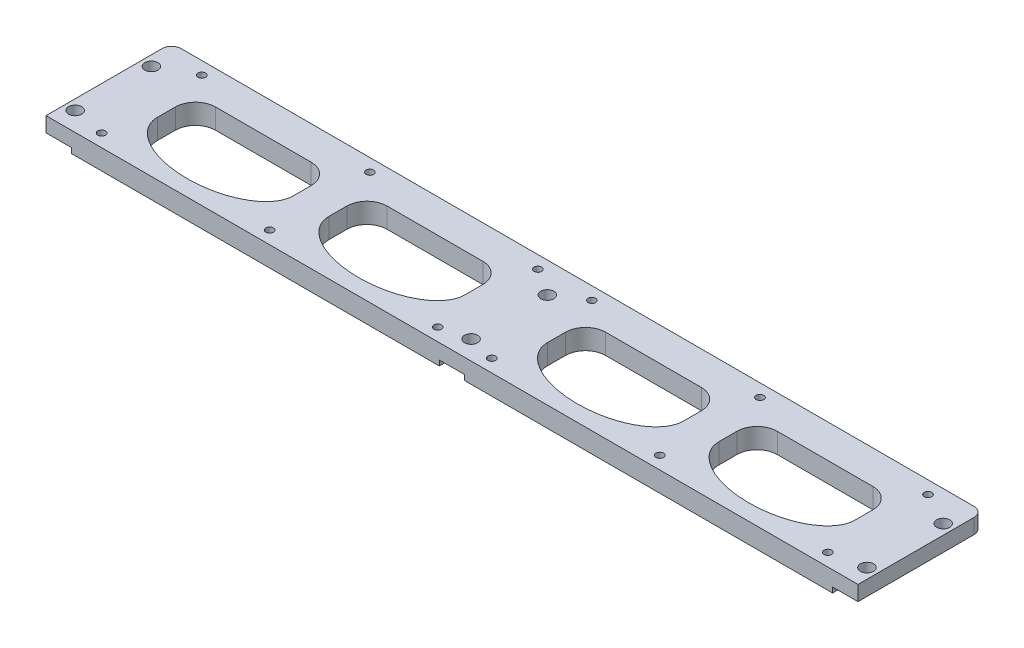
from build123d import *

# Parameters (mm, degrees)
SKETCH4_W                      = 118.3
SKETCH4_H                      = 40.5
BOSS_EXTRUDE1_DEPTH            = 12.7
CUT_EXTRUDE1_DEPTH             = 75.078168174
FILLET1_R                      = 3.175
LPATTERN1_COUNT                = 2
LPATTERN1_PITCH                = 27
FILLET1_OF_LPATTERN1_R         = 3.175
MIRROR1_DEPTH                  = 12.7
SKETCH8_R                      = 0.85
CUT_EXTRUDE2_DEPTH             = 75.078168329
MIRROR3_COPY_1_SKETCH_R        = 0.85
MIRROR3_COPY_1_DEPTH           = 75.078168329
SKETCH14_W                     = 118.3
SKETCH14_H                     = 0.96
SKETCH14_W_2                   = 4.5
SKETCH14_H_2                   = 40.5
CUT_EXTRUDE7_DEPTH             = 0.1
CUT_EXTRUDE8_DEPTH             = 2.35
MIRROR14_COPY_1_DEPTH          = 2.35
MIRROR16_COPY_1_DEPTH          = 2.35
MIRROR16_COPY_2_DEPTH          = 2.35
MIRROR16_COPY_3_DEPTH          = 2.35
CUT_EXTRUDE10_DEPTH            = 75.061089804
SKETCH20_W                     = 127.8
SKETCH20_H                     = 85.5
BOSS_EXTRUDE2_DEPTH            = 3.175
SKETCH22_W                     = 127.8
SKETCH22_H                     = 85.5
CUT_EXTRUDE11_DEPTH            = 78.923440062
CUT_EXTRUDE12_DEPTH            = 77.947080029
F_0_80_TAPPED_HOLE1_D          = 1.19126
MIRROR19_COPY_1_DEPTH          = 77.947080029
MIRROR19_COPY_2_D              = 1.19126
SKETCH26_W                     = 127.8
SKETCH26_H                     = 0.96
CUT_EXTRUDE13_DEPTH            = 3.175
SKETCH27_W                     = 127.8
SKETCH27_H                     = 0.96
CUT_EXTRUDE14_DEPTH            = 3.175
SKETCH29_W                     = 3.175
SKETCH29_H                     = 19.77
CUT_EXTRUDE15_DEPTH            = 0.82
F_1_64_TAPPED_HOLE1_AT_2_COUNT = 2
F_1_64_TAPPED_HOLE1_AT_2_PITCH = 10
SKETCH36_R                     = 0.8
CUT_EXTRUDE16_DEPTH            = 10
FILLET2_R                      = 1.5
FILLET3_R                      = 1.5
F_1_64_TAPPED_HOLE2_AT_2_COUNT = 2
F_1_64_TAPPED_HOLE2_AT_2_PITCH = 10
SKETCH39_W                     = 135.315931577
SKETCH39_H                     = 75.162789903
CUT_EXTRUDE17_DEPTH            = 10
SKETCH40_R                     = 0.8
SKETCH40_R_2                   = 0.8001
CUT_EXTRUDE18_DEPTH            = 10
CUT_EXTRUDE19_DEPTH            = 0.82
SKETCH42_W                     = 4
SKETCH42_H                     = 20.699896909
SKETCH42_H_2                   = 19.77
CUT_EXTRUDE20_DEPTH            = 0.82
SKETCH43_R                     = 1.03
CUT_EXTRUDE21_DEPTH            = 10


# Read off the part's stored shape, not the designer's step: Mirror1
with BuildPart() as part:
    # Sketch4 → Boss-Extrude1 (new body)
    with BuildSketch(Plane(origin=(0, 0, 0), x_dir=(1, 0, 0), z_dir=(0, 1, 0))):
        with Locations((0, 22.5)):
            Rectangle(SKETCH4_W, SKETCH4_H)
    extrude(amount=BOSS_EXTRUDE1_DEPTH)

    # Sketch5 → Cut-Extrude1 (cut, through all)
    with BuildSketch(Plane(origin=(0, 12.7, 0), x_dir=(1, 0, 0), z_dir=(0, 1, 0))):
        with BuildLine():
            Line((-54.9, 13.5), (-54.9, 7.5))
            Line((-54.9, 7.5), (-33.5, 7.5))
            Line((-33.5, 7.5), (-33.5, 13.5))
            add(Edge.make_bspline(
                [(-33.5, 13.5), (-33.5, 19.5), (-44.2, 19.5), (-54.9, 19.5), (-54.9, 13.5)],
                knots=[3.141592654, 3.141592654, 3.141592654, 4.71238898, 4.71238898, 6.283185307, 6.283185307, 6.283185307], degree=2, weights=[1, 0.707106781, 1, 0.707106781, 1]))
        make_face()
        with BuildLine():
            Line((-54.9, 37.5), (-33.5, 37.5))
            Line((-33.5, 37.5), (-33.5, 31.5))
            add(Edge.make_bspline(
                [(-54.9, 31.5), (-54.9, 25.5), (-44.2, 25.5), (-33.5, 25.5), (-33.5, 31.5)],
                knots=[0, 0, 0, 1.570796327, 1.570796327, 3.141592654, 3.141592654, 3.141592654], degree=2, weights=[1, 0.707106781, 1, 0.707106781, 1]))
            Line((-54.9, 31.5), (-54.9, 37.5))
        make_face()
    cut_extrude1 = extrude(amount=-CUT_EXTRUDE1_DEPTH, mode=Mode.SUBTRACT)

    # Fillet1
    fillet1_edges = [part.edges().sort_by_distance(p)[0] for p in [
        (-33.5, 6.35, -7.5),
        (-54.9, 6.35, -7.5),
        (-54.9, 6.35, -37.5),
        (-33.5, 6.35, -37.5),
    ]]
    fillet(fillet1_edges, radius=FILLET1_R)

    # LPattern1: Cut-Extrude1 ×2
    with Locations(*[(i * LPATTERN1_PITCH, 0, 0) for i in range(1, LPATTERN1_COUNT)]):
        add(cut_extrude1, mode=Mode.SUBTRACT)

    # Fillet1 of LPattern1
    fillet1_of_lpattern1_edges = [part.edges().sort_by_distance(p)[0] for p in [
        (-6.5, 6.35, -7.5),
        (-27.9, 6.35, -7.5),
        (-27.9, 6.35, -37.5),
        (-6.5, 6.35, -37.5),
    ]]
    fillet(fillet1_of_lpattern1_edges, radius=FILLET1_OF_LPATTERN1_R)

    # Mirror1 outline → Mirror1 (cut)
    with BuildSketch(Plane(origin=(0, 0, 0), x_dir=(1, 0, 0), z_dir=(0, 1, 0))):
        with BuildLine():
            add(Edge.make_bspline(
                [(33.5, 13.5), (33.5, 19.5), (44.2, 19.5), (54.9, 19.5), (54.9, 13.5)],
                knots=[3.141592654, 3.141592654, 3.141592654, 4.71238898, 4.71238898, 6.283185307, 6.283185307, 6.283185307], degree=2, weights=[1, 0.707106781, 1, 0.707106781, 1]))
            Line((33.5, 13.5), (33.5, 10.675))
            ThreePointArc((33.5, 10.675), (34.42993597, 8.42993597), (36.675, 7.5))
            Line((36.675, 7.5), (51.725, 7.5))
            ThreePointArc((51.725, 7.5), (53.97006403, 8.42993597), (54.9, 10.675))
            Line((54.9, 10.675), (54.9, 13.5))
        make_face()
        with BuildLine():
            add(Edge.make_bspline(
                [(54.9, 31.5), (54.9, 25.5), (44.2, 25.5), (33.5, 25.5), (33.5, 31.5)],
                knots=[0, 0, 0, 1.570796327, 1.570796327, 3.141592654, 3.141592654, 3.141592654], degree=2, weights=[1, 0.707106781, 1, 0.707106781, 1]))
            Line((54.9, 31.5), (54.9, 34.325))
            ThreePointArc((54.9, 34.325), (53.97006403, 36.57006403), (51.725, 37.5))
            Line((51.725, 37.5), (36.675, 37.5))
            ThreePointArc((36.675, 37.5), (34.42993597, 36.57006403), (33.5, 34.325))
            Line((33.5, 34.325), (33.5, 31.5))
        make_face()
        with BuildLine():
            add(Edge.make_bspline(
                [(6.5, 13.5), (6.5, 19.5), (17.2, 19.5), (27.9, 19.5), (27.9, 13.5)],
                knots=[3.141592654, 3.141592654, 3.141592654, 4.71238898, 4.71238898, 6.283185307, 6.283185307, 6.283185307], degree=2, weights=[1, 0.707106781, 1, 0.707106781, 1]))
            Line((6.5, 13.5), (6.5, 10.675))
            ThreePointArc((6.5, 10.675), (7.42993597, 8.42993597), (9.675, 7.5))
            Line((9.675, 7.5), (24.725, 7.5))
            ThreePointArc((24.725, 7.5), (26.97006403, 8.42993597), (27.9, 10.675))
            Line((27.9, 10.675), (27.9, 13.5))
        make_face()
        with BuildLine():
            add(Edge.make_bspline(
                [(27.9, 31.5), (27.9, 25.5), (17.2, 25.5), (6.5, 25.5), (6.5, 31.5)],
                knots=[0, 0, 0, 1.570796327, 1.570796327, 3.141592654, 3.141592654, 3.141592654], degree=2, weights=[1, 0.707106781, 1, 0.707106781, 1]))
            Line((27.9, 31.5), (27.9, 34.325))
            ThreePointArc((27.9, 34.325), (26.97006403, 36.57006403), (24.725, 37.5))
            Line((24.725, 37.5), (9.675, 37.5))
            ThreePointArc((9.675, 37.5), (7.42993597, 36.57006403), (6.5, 34.325))
            Line((6.5, 34.325), (6.5, 31.5))
        make_face()
    extrude(amount=MIRROR1_DEPTH, mode=Mode.SUBTRACT)

    # Sketch8 → Cut-Extrude2 (cut, through all)
    with BuildSketch(Plane(origin=(0, 12.7, 0), x_dir=(1, 0, 0), z_dir=(0, 1, 0))):
        with Locations(Location((-57.15, 40.75, 0), (0, 0, 270))):
            Circle(SKETCH8_R)
        with Locations(Location((-30.7, 40.75, 0), (0, 0, 270))):
            Circle(SKETCH8_R)
        with Locations(Location((-4.25, 40.75, 0), (0, 0, 270))):
            Circle(SKETCH8_R)
        with Locations(Location((-4.25, 24.98, 0), (0, 0, 270))):
            Circle(SKETCH8_R)
        with Locations(Location((-30.7, 24.98, 0), (0, 0, 270))):
            Circle(SKETCH8_R)
        with Locations(Location((-57.15, 24.98, 0), (0, 0, 270))):
            Circle(SKETCH8_R)
    cut_extrude2 = extrude(amount=-CUT_EXTRUDE2_DEPTH, mode=Mode.SUBTRACT)

    # Mirror2: Cut-Extrude2 across plane
    add(cut_extrude2.mirror(Plane.XY.offset(-22.5)), mode=Mode.SUBTRACT)

    # Mirror3: Cut-Extrude2 across plane
    add(cut_extrude2.mirror(Plane(origin=(0, 0, 0), x_dir=(0, 0, 1), z_dir=(1, 0, 0))), mode=Mode.SUBTRACT)

    # Mirror3 copy 1 sketch → Mirror3 copy 1 (cut, through all)
    with BuildSketch(Plane(origin=(0, 12.7, -45), x_dir=(-1, 0, 0), z_dir=(0, 1, 0))):
        with Locations(Location((-57.15, 40.75, 0), (0, 0, 270))):
            Circle(MIRROR3_COPY_1_SKETCH_R)
        with Locations(Location((-30.7, 40.75, 0), (0, 0, 270))):
            Circle(MIRROR3_COPY_1_SKETCH_R)
        with Locations(Location((-4.25, 40.75, 0), (0, 0, 270))):
            Circle(MIRROR3_COPY_1_SKETCH_R)
        with Locations(Location((-4.25, 24.98, 0), (0, 0, 270))):
            Circle(MIRROR3_COPY_1_SKETCH_R)
        with Locations(Location((-30.7, 24.98, 0), (0, 0, 270))):
            Circle(MIRROR3_COPY_1_SKETCH_R)
        with Locations(Location((-57.15, 24.98, 0), (0, 0, 270))):
            Circle(MIRROR3_COPY_1_SKETCH_R)
    extrude(amount=-MIRROR3_COPY_1_DEPTH, mode=Mode.SUBTRACT)

    # Sketch14 → Cut-Extrude7 (cut)
    with BuildSketch(Plane(origin=(0, 12.7, 0), x_dir=(1, 0, 0), z_dir=(0, 1, 0))):
        with Locations((0, 22.5)):
            Rectangle(SKETCH14_W, SKETCH14_H)
        with Locations((0, 22.5)):
            Rectangle(SKETCH14_W_2, SKETCH14_H_2)
    extrude(amount=-CUT_EXTRUDE7_DEPTH, mode=Mode.SUBTRACT)

    # Sketch15 → Cut-Extrude8 (cut)
    with BuildSketch(Plane(origin=(0, 12.7, 0), x_dir=(1, 0, 0), z_dir=(0, 1, 0))):
        with BuildLine():
            Line((-33.875, 42.75), (-27.525, 42.75))
            Line((-27.525, 42.75), (-27.525, 41.5))
            ThreePointArc((-27.525, 41.5), (-30.7, 38.325), (-33.875, 41.5))
            Line((-33.875, 41.5), (-33.875, 42.75))
        make_face()
        with BuildLine():
            Line((-2.25, 42.75), (-6.675, 42.75))
            Line((-6.675, 42.75), (-6.675, 41.5))
            ThreePointArc((-6.675, 41.5), (-5.74506403, 39.25493597), (-3.5, 38.325))
            Line((-3.5, 38.325), (-2.25, 38.325))
            Line((-2.25, 38.325), (-2.25, 42.75))
        make_face()
        with BuildLine():
            Line((-59.15, 42.75), (-54.725, 42.75))
            Line((-54.725, 42.75), (-54.725, 41.5))
            ThreePointArc((-54.725, 41.5), (-55.65493597, 39.25493597), (-57.9, 38.325))
            Line((-57.9, 38.325), (-59.15, 38.325))
            Line((-59.15, 38.325), (-59.15, 42.75))
        make_face()
    cut_extrude8 = extrude(amount=-CUT_EXTRUDE8_DEPTH, mode=Mode.SUBTRACT)

    # Mirror6: Cut-Extrude8 across plane
    add(cut_extrude8.mirror(Plane(origin=(0, 0, -32.865), x_dir=(1, 0, 0), z_dir=(0, 0, -1))), mode=Mode.SUBTRACT)

    # Mirror14: Cut-Extrude8 across plane
    add(cut_extrude8.mirror(Plane(origin=(0, 0, 0), x_dir=(0, 0, 1), z_dir=(1, 0, 0))), mode=Mode.SUBTRACT)

    # Mirror14 copy 1 sketch → Mirror14 copy 1 (cut)
    with BuildSketch(Plane(origin=(0, 12.7, -65.73), x_dir=(-1, 0, 0), z_dir=(0, 1, 0))):
        with BuildLine():
            Line((-33.875, 42.75), (-27.525, 42.75))
            Line((-27.525, 42.75), (-27.525, 41.5))
            ThreePointArc((-27.525, 41.5), (-30.7, 38.325), (-33.875, 41.5))
            Line((-33.875, 41.5), (-33.875, 42.75))
        make_face()
        with BuildLine():
            Line((-2.25, 42.75), (-6.675, 42.75))
            Line((-6.675, 42.75), (-6.675, 41.5))
            ThreePointArc((-6.675, 41.5), (-5.74506403, 39.25493597), (-3.5, 38.325))
            Line((-3.5, 38.325), (-2.25, 38.325))
            Line((-2.25, 38.325), (-2.25, 42.75))
        make_face()
        with BuildLine():
            Line((-59.15, 42.75), (-54.725, 42.75))
            Line((-54.725, 42.75), (-54.725, 41.5))
            ThreePointArc((-54.725, 41.5), (-55.65493597, 39.25493597), (-57.9, 38.325))
            Line((-57.9, 38.325), (-59.15, 38.325))
            Line((-59.15, 38.325), (-59.15, 42.75))
        make_face()
    extrude(amount=-MIRROR14_COPY_1_DEPTH, mode=Mode.SUBTRACT)

    # Mirror16: Cut-Extrude8 across plane
    add(cut_extrude8.mirror(Plane.XY.offset(-22.5)), mode=Mode.SUBTRACT)

    # Mirror16 copy 1 sketch → Mirror16 copy 1 (cut)
    with BuildSketch(Plane(origin=(0, 12.7, 20.73), x_dir=(1, 0, 0), z_dir=(0, 1, 0))):
        with BuildLine():
            Line((-33.875, 42.75), (-27.525, 42.75))
            Line((-27.525, 42.75), (-27.525, 41.5))
            ThreePointArc((-27.525, 41.5), (-30.7, 38.325), (-33.875, 41.5))
            Line((-33.875, 41.5), (-33.875, 42.75))
        make_face()
        with BuildLine():
            Line((-2.25, 42.75), (-6.675, 42.75))
            Line((-6.675, 42.75), (-6.675, 41.5))
            ThreePointArc((-6.675, 41.5), (-5.74506403, 39.25493597), (-3.5, 38.325))
            Line((-3.5, 38.325), (-2.25, 38.325))
            Line((-2.25, 38.325), (-2.25, 42.75))
        make_face()
        with BuildLine():
            Line((-59.15, 42.75), (-54.725, 42.75))
            Line((-54.725, 42.75), (-54.725, 41.5))
            ThreePointArc((-54.725, 41.5), (-55.65493597, 39.25493597), (-57.9, 38.325))
            Line((-57.9, 38.325), (-59.15, 38.325))
            Line((-59.15, 38.325), (-59.15, 42.75))
        make_face()
    extrude(amount=-MIRROR16_COPY_1_DEPTH, mode=Mode.SUBTRACT)

    # Mirror16 copy 2 sketch → Mirror16 copy 2 (cut)
    with BuildSketch(Plane(origin=(0, 12.7, -45), x_dir=(-1, 0, 0), z_dir=(0, 1, 0))):
        with BuildLine():
            Line((-33.875, 42.75), (-27.525, 42.75))
            Line((-27.525, 42.75), (-27.525, 41.5))
            ThreePointArc((-27.525, 41.5), (-30.7, 38.325), (-33.875, 41.5))
            Line((-33.875, 41.5), (-33.875, 42.75))
        make_face()
        with BuildLine():
            Line((-2.25, 42.75), (-6.675, 42.75))
            Line((-6.675, 42.75), (-6.675, 41.5))
            ThreePointArc((-6.675, 41.5), (-5.74506403, 39.25493597), (-3.5, 38.325))
            Line((-3.5, 38.325), (-2.25, 38.325))
            Line((-2.25, 38.325), (-2.25, 42.75))
        make_face()
        with BuildLine():
            Line((-59.15, 42.75), (-54.725, 42.75))
            Line((-54.725, 42.75), (-54.725, 41.5))
            ThreePointArc((-54.725, 41.5), (-55.65493597, 39.25493597), (-57.9, 38.325))
            Line((-57.9, 38.325), (-59.15, 38.325))
            Line((-59.15, 38.325), (-59.15, 42.75))
        make_face()
    extrude(amount=-MIRROR16_COPY_2_DEPTH, mode=Mode.SUBTRACT)

    # Mirror16 copy 3 sketch → Mirror16 copy 3 (cut)
    with BuildSketch(Plane(origin=(0, 12.7, 20.73), x_dir=(-1, 0, 0), z_dir=(0, 1, 0))):
        with BuildLine():
            Line((-33.875, -42.75), (-27.525, -42.75))
            Line((-27.525, -42.75), (-27.525, -41.5))
            ThreePointArc((-27.525, -41.5), (-30.7, -38.325), (-33.875, -41.5))
            Line((-33.875, -41.5), (-33.875, -42.75))
        make_face()
        with BuildLine():
            Line((-2.25, -42.75), (-6.675, -42.75))
            Line((-6.675, -42.75), (-6.675, -41.5))
            ThreePointArc((-6.675, -41.5), (-5.74506403, -39.25493597), (-3.5, -38.325))
            Line((-3.5, -38.325), (-2.25, -38.325))
            Line((-2.25, -38.325), (-2.25, -42.75))
        make_face()
        with BuildLine():
            Line((-59.15, -42.75), (-54.725, -42.75))
            Line((-54.725, -42.75), (-54.725, -41.5))
            ThreePointArc((-54.725, -41.5), (-55.65493597, -39.25493597), (-57.9, -38.325))
            Line((-57.9, -38.325), (-59.15, -38.325))
            Line((-59.15, -38.325), (-59.15, -42.75))
        make_face()
    extrude(amount=-MIRROR16_COPY_3_DEPTH, mode=Mode.SUBTRACT)

    # Sketch17 → Cut-Extrude10 (cut, through all)
    with BuildSketch(Plane(origin=(0, 12.6, 0), x_dir=(1, 0, 0), z_dir=(0, 1, 0))):
        Polygon((-54.725, 22.98), (-59.15, 22.98), (-59.15, 22.02), (-54.725, 22.02), (-33.875, 22.02), (-27.525, 22.02), (-6.675, 22.02), (-2.25, 22.02), (-2.25, 17.595), (-2.25, 6.675), (-2.25, 2.25), (2.25, 2.25), (2.25, 6.675), (2.25, 17.595), (2.25, 22.02), (6.675, 22.02), (27.525, 22.02), (33.875, 22.02), (54.725, 22.02), (59.15, 22.02), (59.15, 22.98), (54.725, 22.98), (33.875, 22.98), (27.525, 22.98), (6.675, 22.98), (2.25, 22.98), (2.25, 27.405), (2.25, 38.325), (2.25, 42.75), (-2.25, 42.75), (-2.25, 38.325), (-2.25, 27.405), (-2.25, 22.98), (-6.675, 22.98), (-27.525, 22.98), (-33.875, 22.98), align=None)
    extrude(amount=-CUT_EXTRUDE10_DEPTH, mode=Mode.SUBTRACT)


with BuildPart() as cut_extrude10_piece_1:
    # of the separate pieces the step leaves, piece 1, a body of its own (cut_extrude10_pieces)
    add(part.part.solids().sort_by_distance((59.15, 0, -22.02))[0])



with BuildPart() as cut_extrude10_piece_2:
    # of the separate pieces the step leaves, piece 2, a body of its own (cut_extrude10_pieces)
    add(part.part.solids().sort_by_distance((2.25, 0, -42.75))[0])


with BuildPart() as cut_extrude10_piece_3:
    # of the separate pieces the step leaves, piece 3, a body of its own (cut_extrude10_pieces)
    add(part.part.solids().sort_by_distance((-59.15, 0, -2.25))[0])


with BuildPart() as cut_extrude10_piece_4:
    # of the separate pieces the step leaves, piece 4, a body of its own (cut_extrude10_pieces)
    add(part.part.solids().sort_by_distance((-59.15, 0, -22.98))[0])


with BuildPart() as cut_extrude10_piece_1_1:
    add(cut_extrude10_piece_1.part)

    add(cut_extrude10_piece_2.part)  # Boss-Extrude2 merges Cut-Extrude10 piece 2

    add(cut_extrude10_piece_3.part)  # Boss-Extrude2 merges Cut-Extrude10 piece 3

    add(cut_extrude10_piece_4.part)  # Boss-Extrude2 merges Cut-Extrude10 piece 4
    # Sketch20 → Boss-Extrude2 (add)
    with BuildSketch(Plane(origin=(0, 0, 0), x_dir=(1, 0, 0), z_dir=(0, 1, 0))):
        Rectangle(SKETCH20_W, SKETCH20_H)
    extrude(amount=-BOSS_EXTRUDE2_DEPTH)

    # Sketch22 → Cut-Extrude11 (cut, through all)
    with BuildSketch(Plane(origin=(0, 0, 0), x_dir=(1, 0, 0), z_dir=(0, 1, 0))):
        Rectangle(SKETCH22_W, SKETCH22_H)
    extrude(amount=CUT_EXTRUDE11_DEPTH, mode=Mode.SUBTRACT)

    # Sketch23 → Cut-Extrude12 (cut, through all)
    with BuildSketch(Plane(origin=(0, 0, 0), x_dir=(1, 0, 0), z_dir=(0, 1, 0))):
        with BuildLine():
            Line((-36.675, 37.5), (-51.725, 37.5))
            ThreePointArc((-51.725, 37.5), (-53.97006403, 36.57006403), (-54.9, 34.325))
            Line((-54.9, 34.325), (-54.9, 31.5))
            add(Edge.make_bspline(
                [(-54.9, 31.5), (-54.9, 25.5), (-44.2, 25.5), (-33.5, 25.5), (-33.5, 31.5)],
                knots=[0, 0, 0, 1.570796327, 1.570796327, 3.141592654, 3.141592654, 3.141592654], degree=2, weights=[1, 0.707106781, 1, 0.707106781, 1]))
            Line((-33.5, 31.5), (-33.5, 34.325))
            ThreePointArc((-33.5, 34.325), (-34.42993597, 36.57006403), (-36.675, 37.5))
        make_face()
        with BuildLine():
            Line((-9.675, 37.5), (-24.725, 37.5))
            ThreePointArc((-24.725, 37.5), (-26.97006403, 36.57006403), (-27.9, 34.325))
            Line((-27.9, 34.325), (-27.9, 31.5))
            add(Edge.make_bspline(
                [(-27.9, 31.5), (-27.9, 25.5), (-17.2, 25.5), (-6.5, 25.5), (-6.5, 31.5)],
                knots=[0, 0, 0, 1.570796327, 1.570796327, 3.141592654, 3.141592654, 3.141592654], degree=2, weights=[1, 0.707106781, 1, 0.707106781, 1]))
            Line((-6.5, 31.5), (-6.5, 34.325))
            ThreePointArc((-6.5, 34.325), (-7.42993597, 36.57006403), (-9.675, 37.5))
        make_face()
        with BuildLine():
            Line((-54.9, 13.5), (-54.9, 10.675))
            ThreePointArc((-54.9, 10.675), (-53.97006403, 8.42993597), (-51.725, 7.5))
            Line((-51.725, 7.5), (-36.675, 7.5))
            ThreePointArc((-36.675, 7.5), (-34.42993597, 8.42993597), (-33.5, 10.675))
            Line((-33.5, 10.675), (-33.5, 13.5))
            add(Edge.make_bspline(
                [(-33.5, 13.5), (-33.5, 19.5), (-44.2, 19.5), (-54.9, 19.5), (-54.9, 13.5)],
                knots=[3.141592654, 3.141592654, 3.141592654, 4.71238898, 4.71238898, 6.283185307, 6.283185307, 6.283185307], degree=2, weights=[1, 0.707106781, 1, 0.707106781, 1]))
        make_face()
        with BuildLine():
            Line((-27.9, 13.5), (-27.9, 10.675))
            ThreePointArc((-27.9, 10.675), (-26.97006403, 8.42993597), (-24.725, 7.5))
            Line((-24.725, 7.5), (-9.675, 7.5))
            ThreePointArc((-9.675, 7.5), (-7.42993597, 8.42993597), (-6.5, 10.675))
            Line((-6.5, 10.675), (-6.5, 13.5))
            add(Edge.make_bspline(
                [(-6.5, 13.5), (-6.5, 19.5), (-17.2, 19.5), (-27.9, 19.5), (-27.9, 13.5)],
                knots=[3.141592654, 3.141592654, 3.141592654, 4.71238898, 4.71238898, 6.283185307, 6.283185307, 6.283185307], degree=2, weights=[1, 0.707106781, 1, 0.707106781, 1]))
        make_face()
    cut_extrude12 = extrude(amount=-CUT_EXTRUDE12_DEPTH, mode=Mode.SUBTRACT)

    # #0-80 Tapped Hole1 (through all)
    with Locations(Plane(origin=(0, 0, 0), x_dir=(1, 0, 0), z_dir=(0, 1, 0))):
        with Locations((-57.15, 40.75), (-30.7, 40.75), (-4.25, 40.75), (-4.25, 24.98), (-30.7, 24.98), (-30.7, 20.02), (-57.15, 24.98), (-57.15, 20.02), (-4.25, 20.02), (-4.25, 4.25), (-30.7, 4.25), (-57.15, 4.25)):
            f_0_80_tapped_hole1 = Hole(F_0_80_TAPPED_HOLE1_D / 2)

    # Mirror18: Cut-Extrude12, #0-80 Tapped Hole1 across plane
    add(cut_extrude12.mirror(Plane(origin=(0, 0, 0), x_dir=(0, 0, 1), z_dir=(1, 0, 0))), mode=Mode.SUBTRACT)
    add(f_0_80_tapped_hole1.mirror(Plane(origin=(0, 0, 0), x_dir=(0, 0, 1), z_dir=(1, 0, 0))), mode=Mode.SUBTRACT)

    # Mirror19: Cut-Extrude12, #0-80 Tapped Hole1 across plane
    add(cut_extrude12.mirror(Plane(origin=(0, 0, 0), x_dir=(1, 0, 0), z_dir=(0, 0, -1))), mode=Mode.SUBTRACT)
    add(f_0_80_tapped_hole1.mirror(Plane(origin=(0, 0, 0), x_dir=(1, 0, 0), z_dir=(0, 0, -1))), mode=Mode.SUBTRACT)

    # Mirror19 copy 1 sketch → Mirror19 copy 1 (cut, through all)
    with BuildSketch(Plane(origin=(0, 0, 0), x_dir=(-1, 0, 0), z_dir=(0, 1, 0))):
        with BuildLine():
            Line((-36.675, 37.5), (-51.725, 37.5))
            ThreePointArc((-51.725, 37.5), (-53.97006403, 36.57006403), (-54.9, 34.325))
            Line((-54.9, 34.325), (-54.9, 31.5))
            add(Edge.make_bspline(
                [(-54.9, 31.5), (-54.9, 25.5), (-44.2, 25.5), (-33.5, 25.5), (-33.5, 31.5)],
                knots=[0, 0, 0, 1.570796327, 1.570796327, 3.141592654, 3.141592654, 3.141592654], degree=2, weights=[1, 0.707106781, 1, 0.707106781, 1]))
            Line((-33.5, 31.5), (-33.5, 34.325))
            ThreePointArc((-33.5, 34.325), (-34.42993597, 36.57006403), (-36.675, 37.5))
        make_face()
        with BuildLine():
            Line((-9.675, 37.5), (-24.725, 37.5))
            ThreePointArc((-24.725, 37.5), (-26.97006403, 36.57006403), (-27.9, 34.325))
            Line((-27.9, 34.325), (-27.9, 31.5))
            add(Edge.make_bspline(
                [(-27.9, 31.5), (-27.9, 25.5), (-17.2, 25.5), (-6.5, 25.5), (-6.5, 31.5)],
                knots=[0, 0, 0, 1.570796327, 1.570796327, 3.141592654, 3.141592654, 3.141592654], degree=2, weights=[1, 0.707106781, 1, 0.707106781, 1]))
            Line((-6.5, 31.5), (-6.5, 34.325))
            ThreePointArc((-6.5, 34.325), (-7.42993597, 36.57006403), (-9.675, 37.5))
        make_face()
        with BuildLine():
            Line((-54.9, 13.5), (-54.9, 10.675))
            ThreePointArc((-54.9, 10.675), (-53.97006403, 8.42993597), (-51.725, 7.5))
            Line((-51.725, 7.5), (-36.675, 7.5))
            ThreePointArc((-36.675, 7.5), (-34.42993597, 8.42993597), (-33.5, 10.675))
            Line((-33.5, 10.675), (-33.5, 13.5))
            add(Edge.make_bspline(
                [(-33.5, 13.5), (-33.5, 19.5), (-44.2, 19.5), (-54.9, 19.5), (-54.9, 13.5)],
                knots=[3.141592654, 3.141592654, 3.141592654, 4.71238898, 4.71238898, 6.283185307, 6.283185307, 6.283185307], degree=2, weights=[1, 0.707106781, 1, 0.707106781, 1]))
        make_face()
        with BuildLine():
            Line((-27.9, 13.5), (-27.9, 10.675))
            ThreePointArc((-27.9, 10.675), (-26.97006403, 8.42993597), (-24.725, 7.5))
            Line((-24.725, 7.5), (-9.675, 7.5))
            ThreePointArc((-9.675, 7.5), (-7.42993597, 8.42993597), (-6.5, 10.675))
            Line((-6.5, 10.675), (-6.5, 13.5))
            add(Edge.make_bspline(
                [(-6.5, 13.5), (-6.5, 19.5), (-17.2, 19.5), (-27.9, 19.5), (-27.9, 13.5)],
                knots=[3.141592654, 3.141592654, 3.141592654, 4.71238898, 4.71238898, 6.283185307, 6.283185307, 6.283185307], degree=2, weights=[1, 0.707106781, 1, 0.707106781, 1]))
        make_face()
    extrude(amount=-MIRROR19_COPY_1_DEPTH, mode=Mode.SUBTRACT)

    # Mirror19 copy 2 (through all)
    with Locations(Plane(origin=(0, 0, 0), x_dir=(-1, 0, 0), z_dir=(0, 1, 0))):
        with Locations((-57.15, 40.75), (-30.7, 40.75), (-4.25, 40.75), (-4.25, 24.98), (-30.7, 24.98), (-30.7, 20.02), (-57.15, 24.98), (-57.15, 20.02), (-4.25, 20.02), (-4.25, 4.25), (-30.7, 4.25), (-57.15, 4.25)):
            Hole(MIRROR19_COPY_2_D / 2)

    # Sketch26 → Cut-Extrude13 (cut)
    with BuildSketch(Plane(origin=(0, 0, 0), x_dir=(1, 0, 0), z_dir=(0, 1, 0))):
        with Locations((0, 22.5)):
            Rectangle(SKETCH26_W, SKETCH26_H)
    extrude(amount=-CUT_EXTRUDE13_DEPTH, mode=Mode.SUBTRACT)


with BuildPart() as cut_extrude13_piece_1:
    # of the separate pieces the step leaves, piece 1, a body of its own (cut_extrude13_pieces)
    add(cut_extrude10_piece_1_1.part.solids().sort_by_distance((63.9, 0, -22.02))[0])

    # Sketch27 → Cut-Extrude14 (cut)
    with BuildSketch(Plane(origin=(0, 0, 0), x_dir=(1, 0, 0), z_dir=(0, 1, 0))):
        with Locations((0, -22.5)):
            Rectangle(SKETCH27_W, SKETCH27_H)
    extrude(amount=-CUT_EXTRUDE14_DEPTH, mode=Mode.SUBTRACT)


with BuildPart() as cut_extrude13_piece_2:
    # of the separate pieces the step leaves, piece 2, a body of its own (cut_extrude13_pieces)
    add(cut_extrude10_piece_1_1.part.solids().sort_by_distance((-63.9, 0, -42.75))[0])


with BuildPart() as cut_extrude14_piece_1:
    # of the separate pieces the step leaves, piece 1, a body of its own (cut_extrude14_pieces)
    add(cut_extrude13_piece_1.part.solids().sort_by_distance((63.9, 0, -22.02))[0])

    # Sketch30 → #1-64 Tapped Hole1 (revolve, cut)
    with BuildSketch(Plane(origin=(62.3125, 0, -5), x_dir=(0, 0, 1), z_dir=(1, 0, 0))):
        Polygon((0, 0), (0, 6.144040327), (0.75565, 5.69), (0.75565, 0), align=None)
    f_1_64_tapped_hole1 = revolve(axis=Axis((62.3125, 6.35, -5), (0, -1, 0)), mode=Mode.SUBTRACT)

    # #1-64 Tapped Hole1 at 2: #1-64 Tapped Hole1 ×2
    with Locations(*[(0, 0, i * F_1_64_TAPPED_HOLE1_AT_2_PITCH) for i in range(1, F_1_64_TAPPED_HOLE1_AT_2_COUNT)]):
        add(f_1_64_tapped_hole1, mode=Mode.SUBTRACT)


with BuildPart() as cut_extrude14_piece_2:
    # of the separate pieces the step leaves, piece 2, a body of its own (cut_extrude14_pieces)
    add(cut_extrude13_piece_1.part.solids().sort_by_distance((63.9, 0, 22.98))[0])


with BuildPart() as cut_extrude15_tool:
    # Sketch29 → Cut-Extrude15 (new body)
    with BuildSketch(Plane.XZ.offset(3.175)):
        with Locations((62.3125, -32.865)):
            Rectangle(SKETCH29_W, SKETCH29_H)
        with Locations((62.3125, 32.865)):
            Rectangle(SKETCH29_W, SKETCH29_H)
    cut_extrude15 = extrude(amount=-CUT_EXTRUDE15_DEPTH)


with BuildPart() as cut_extrude13_piece_2_1:
    add(cut_extrude13_piece_2.part)

    # Cut-Extrude15: cut by cut_extrude15_tool
    add(cut_extrude15_tool.part, mode=Mode.SUBTRACT)


with BuildPart() as cut_extrude14_piece_2_1:
    add(cut_extrude14_piece_2.part)

    # Cut-Extrude15: cut by cut_extrude15_tool
    add(cut_extrude15_tool.part, mode=Mode.SUBTRACT)


with BuildPart() as cut_extrude16_tool:
    # Sketch36 → Cut-Extrude16 (new body)
    with BuildSketch(Plane.XZ.offset(2.355)):
        with Locations(Location((62.3125, 37.98, 0), (0, 0, 270))):
            Circle(SKETCH36_R)
        with Locations(Location((62.3125, 25.98, 0), (0, 0, 270))):
            Circle(SKETCH36_R)
        with Locations(Location((62.3125, -25.98, 0), (0, 0, 270))):
            Circle(SKETCH36_R)
        with Locations(Location((62.3125, -37.98, 0), (0, 0, 270))):
            Circle(SKETCH36_R)
    cut_extrude16 = extrude(amount=-CUT_EXTRUDE16_DEPTH)


with BuildPart() as cut_extrude13_piece_2_2:
    add(cut_extrude13_piece_2_1.part)

    # Cut-Extrude16: cut by cut_extrude16_tool
    add(cut_extrude16_tool.part, mode=Mode.SUBTRACT)


with BuildPart() as cut_extrude14_piece_2_2:
    add(cut_extrude14_piece_2_1.part)

    # Cut-Extrude16: cut by cut_extrude16_tool
    add(cut_extrude16_tool.part, mode=Mode.SUBTRACT)


with BuildPart() as mirror20_tool:
    # Mirror20: Cut-Extrude15, #1-64 Tapped Hole1, Cut-Extrude16 across plane
    add(cut_extrude15.mirror(Plane(origin=(0, 0, 0), x_dir=(0, 0, 1), z_dir=(1, 0, 0))))
    add(f_1_64_tapped_hole1.mirror(Plane(origin=(0, 0, 0), x_dir=(0, 0, 1), z_dir=(1, 0, 0))))
    add(cut_extrude16.mirror(Plane(origin=(0, 0, 0), x_dir=(0, 0, 1), z_dir=(1, 0, 0))))


with BuildPart() as cut_extrude13_piece_2_3:
    add(cut_extrude13_piece_2_2.part)

    # Mirror20: cut by mirror20_tool
    add(mirror20_tool.part, mode=Mode.SUBTRACT)

    # Fillet2
    fillet2_edges = [cut_extrude13_piece_2_3.edges().sort_by_distance(p)[0] for p in [
        (-63.9, -1.1775, -42.75),
        (63.9, -1.1775, -42.75),
    ]]
    fillet(fillet2_edges, radius=FILLET2_R)

    # Sketch40 → Cut-Extrude18 (cut)
    with BuildSketch(Plane(origin=(0, 0, 0), x_dir=(1, 0, 0), z_dir=(0, 1, 0))):
        with Locations(Location((0, 37.98, 0), (0, 0, 270))):
            Circle(SKETCH40_R)
        with Locations(Location((0, 25.98, 0), (0, 0, 270))):
            Circle(SKETCH40_R_2)
    extrude(amount=-CUT_EXTRUDE18_DEPTH, mode=Mode.SUBTRACT)

    # Sketch41 → Cut-Extrude19 (cut)
    with BuildSketch(Plane.XZ.offset(3.175)):
        with BuildLine():
            Line((-1.5875, -22.98), (1.5875, -22.98))
            Line((1.5875, -22.98), (1.5875, -37.98))
            ThreePointArc((1.5875, -37.98), (0, -39.5675), (-1.5875, -37.98))
            Line((-1.5875, -37.98), (-1.5875, -22.98))
        make_face()
    extrude(amount=-CUT_EXTRUDE19_DEPTH, mode=Mode.SUBTRACT)

    # Sketch42 → Cut-Extrude20 (cut)
    with BuildSketch(Plane.XZ.offset(3.175)):
        with Locations((61.9, -32.400051545)):
            Rectangle(SKETCH42_W, SKETCH42_H)
        with Locations((-61.9, -32.865)):
            Rectangle(SKETCH42_W, SKETCH42_H_2)
        with BuildLine():
            Line((-2, -37.98), (-2, -21.98))
            ThreePointArc((-2, -21.98), (0, -19.98), (2, -21.98))
            Line((2, -21.98), (2, -37.98))
            ThreePointArc((2, -37.98), (0, -39.98), (-2, -37.98))
        make_face()
    extrude(amount=-CUT_EXTRUDE20_DEPTH, mode=Mode.SUBTRACT)

    # Sketch43 → Cut-Extrude21 (cut)
    with BuildSketch(Plane.XZ.offset(2.355)):
        with Locations(Location((-62.3125, -25.98, 0), (0, 0, 270))):
            Circle(SKETCH43_R)
        with Locations(Location((-62.3125, -37.98, 0), (0, 0, 270))):
            Circle(SKETCH43_R)
        with Locations(Location((0, -25.98, 0), (0, 0, 270))):
            Circle(SKETCH43_R)
        with Locations(Location((0, -37.98, 0), (0, 0, 270))):
            Circle(SKETCH43_R)
        with Locations(Location((62.3125, -25.98, 0), (0, 0, 270))):
            Circle(SKETCH43_R)
        with Locations(Location((62.3125, -37.98, 0), (0, 0, 270))):
            Circle(SKETCH43_R)
    extrude(amount=-CUT_EXTRUDE21_DEPTH, mode=Mode.SUBTRACT)


with BuildPart() as cut_extrude14_piece_1_1:
    add(cut_extrude14_piece_1.part)

    # Mirror20: cut by mirror20_tool
    add(mirror20_tool.part, mode=Mode.SUBTRACT)

    # Mirror20 copy 1 sketch → Mirror20 copy 1 (revolve, cut)
    with BuildSketch(Plane(origin=(-62.3125, 0, 5), x_dir=(0, 0, 1), z_dir=(-1, 0, 0))):
        Polygon((0, 0), (0, -6.144040327), (0.75565, -5.69), (0.75565, 0), align=None)
    revolve(axis=Axis((-62.3125, 6.35, 5), (0, 1, 0)), mode=Mode.SUBTRACT)

    # Sketch37 → #1-64 Tapped Hole2 (revolve, cut)
    with BuildSketch(Plane(origin=(0, 0, -5), x_dir=(0, 0, 1), z_dir=(1, 0, 0))):
        Polygon((0, 0), (0, 6.144040327), (0.75565, 5.69), (0.75565, 0), align=None)
    f_1_64_tapped_hole2 = revolve(axis=Axis((0, 6.35, -5), (0, -1, 0)), mode=Mode.SUBTRACT)

    # #1-64 Tapped Hole2 at 2: #1-64 Tapped Hole2 ×2
    with Locations(*[(0, 0, i * F_1_64_TAPPED_HOLE2_AT_2_PITCH) for i in range(1, F_1_64_TAPPED_HOLE2_AT_2_COUNT)]):
        add(f_1_64_tapped_hole2, mode=Mode.SUBTRACT)


with BuildPart() as cut_extrude14_piece_2_3:
    add(cut_extrude14_piece_2_2.part)

    # Mirror20: cut by mirror20_tool
    add(mirror20_tool.part, mode=Mode.SUBTRACT)

    # Fillet3
    fillet3_edges = [cut_extrude14_piece_2_3.edges().sort_by_distance(p)[0] for p in [
        (63.9, -1.1775, 42.75),
        (-63.9, -1.1775, 42.75),
    ]]
    fillet(fillet3_edges, radius=FILLET3_R)


with BuildPart() as cut_extrude17_tool:
    # Sketch39 → Cut-Extrude17 (new body)
    with BuildSketch(Plane(origin=(0, 0, 0), x_dir=(1, 0, 0), z_dir=(0, 1, 0))):
        with Locations((3.757965789, -15.561394951)):
            Rectangle(SKETCH39_W, SKETCH39_H)
    extrude(amount=-CUT_EXTRUDE17_DEPTH)


with BuildPart() as cut_extrude14_piece_1_2:
    add(cut_extrude14_piece_1_1.part)

    # Cut-Extrude17: cut by cut_extrude17_tool
    add(cut_extrude17_tool.part, mode=Mode.SUBTRACT)


with BuildPart() as cut_extrude14_piece_2_4:
    add(cut_extrude14_piece_2_3.part)

    # Cut-Extrude17: cut by cut_extrude17_tool
    add(cut_extrude17_tool.part, mode=Mode.SUBTRACT)


solid = cut_extrude13_piece_2_3.part
